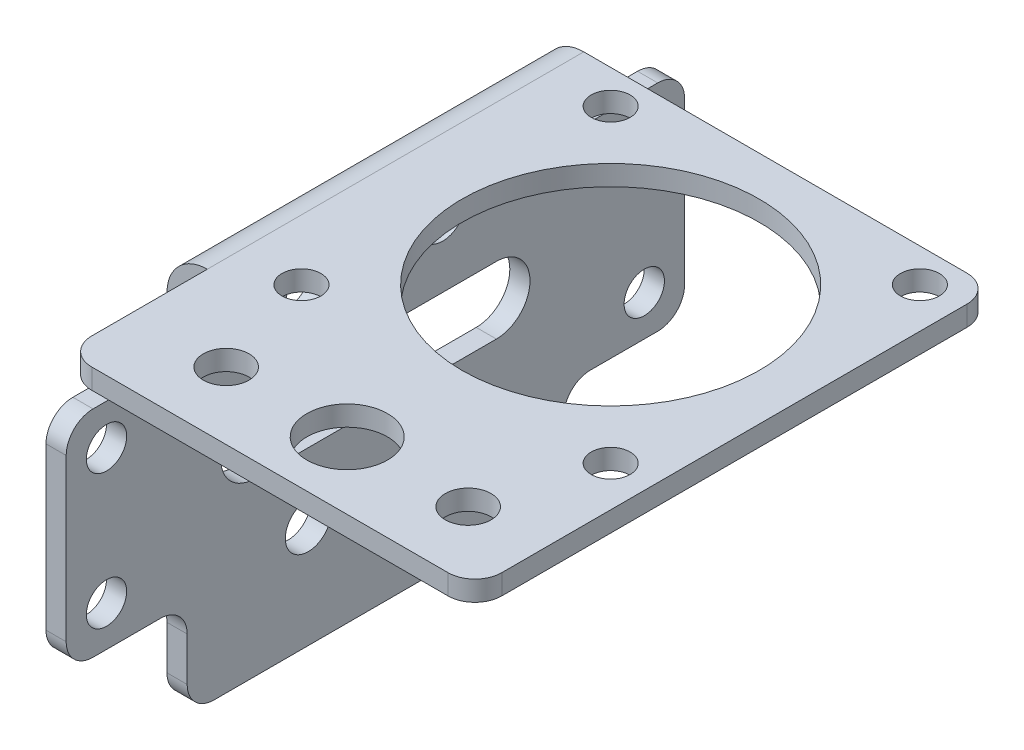
from build123d import *

# Parameters (mm, degrees)
BASE_FLANGE1_DEPTH     = 14
M3_CLEARANCE_HOLE1_D   = 3.4
M2_5_CLEARANCE_HOLE1_D = 2.9
SKETCH10_R             = 11.05
CUT_EXTRUDE1_DEPTH     = 10
SKETCH11_R             = 3
BOSS_EXTRUDE1_DEPTH    = 1.5
M3_CLEARANCE_HOLE2_D   = 3.4
SKETCH14_W             = 9
SKETCH14_H             = 16
SKETCH14_R             = 1.5
BOSS_EXTRUDE2_DEPTH    = 1.5
SKETCH15_W             = 28
SKETCH15_H             = 4
BOSS_EXTRUDE3_DEPTH    = 1.5
FILLET1_R              = 2
CUT_EXTRUDE2_DEPTH     = 10


# Sheet-metal steps are written as plain solids
with BuildPart() as part:
    # Sketch1 → Base-Flange1 (new, symmetric)
    with BuildSketch(Plane.XY):
        with BuildLine():
            Line((0, -24), (0, -1.5))
            ThreePointArc((0, -1.5), (0.439339828, -0.439339828), (1.5, 0))
            Line((1.5, 0), (32, 0))
            Line((32, 0), (32, 1.5))
            Line((32, 1.5), (1.5, 1.5))
            ThreePointArc((1.5, 1.5), (-0.621320344, 0.621320344), (-1.5, -1.5))
            Line((-1.5, -1.5), (-1.5, -24))
            Line((-1.5, -24), (0, -24))
        make_face()
    extrude(amount=BASE_FLANGE1_DEPTH, both=True)

    # M3 Clearance Hole1 (through all)
    with Locations(Plane.ZY.offset(1.5)):
        with Locations((-5, -5.25), (-5, -20.25), (5, -5.25), (5, -20.25)):
            Hole(M3_CLEARANCE_HOLE1_D / 2)

    # M2.5 Clearance Hole1 (through all)
    with Locations(Plane(origin=(0, 1.5, 0), x_dir=(1, 0, 0), z_dir=(0, 1, 0))):
        with Locations((29, 11.5), (29, -11.5), (6, -11.5), (6, 11.5)):
            Hole(M2_5_CLEARANCE_HOLE1_D / 2)

    # Sketch10 → Cut-Extrude1 (cut)
    with BuildSketch(Plane(origin=(0, 1.5, 0), x_dir=(1, 0, 0), z_dir=(0, 1, 0))):
        with Locations(Location((17.5, 0, 0), (0, 0, 270))):
            Circle(SKETCH10_R)
    extrude(amount=-CUT_EXTRUDE1_DEPTH, mode=Mode.SUBTRACT)

    # Sketch11 → Boss-Extrude1 (add)
    with BuildSketch(Plane(origin=(0, 1.5, 0), x_dir=(1, 0, 0), z_dir=(0, 1, 0))):
        Polygon((32, -14), (1.5, -14), (1.5, -24.597), (17.5, -24.597), (32, -24.597), align=None)
        with Locations(Location((17.5, -19.597, 0), (0, 0, 270))):
            Circle(SKETCH11_R, mode=Mode.SUBTRACT)
    extrude(amount=-BOSS_EXTRUDE1_DEPTH)

    # M3 Clearance Hole2 (through all)
    with Locations(Plane(origin=(0, 0, 0), x_dir=(-1, 0, 0), z_dir=(0, -1, 0))):
        with Locations((-26.5, -19.597), (-8.5, -19.597)):
            Hole(M3_CLEARANCE_HOLE2_D / 2)

    # Sketch14 → Boss-Extrude2 (add)
    with BuildSketch(Plane(origin=(0, 0, 0), x_dir=(0, 0, -1), z_dir=(1, 0, 0))):
        with Locations((18.5, -12.75)):
            Rectangle(SKETCH14_W, SKETCH14_H)
        with Locations((20, -7.75)):
            Circle(SKETCH14_R, mode=Mode.SUBTRACT)
        with Locations((20, -17.75)):
            Circle(SKETCH14_R, mode=Mode.SUBTRACT)
    boss_extrude2 = extrude(amount=-BOSS_EXTRUDE2_DEPTH)

    # Mirror1: Boss-Extrude2 across plane
    add(boss_extrude2.mirror(Plane.XY))

    # Sketch15 → Boss-Extrude3 (add)
    with BuildSketch(Plane(origin=(0, 0, 0), x_dir=(0, 0, -1), z_dir=(1, 0, 0))):
        with Locations((0, -26)):
            Rectangle(SKETCH15_W, SKETCH15_H)
    extrude(amount=-BOSS_EXTRUDE3_DEPTH)

    # Fillet1
    fillet1_edges = [part.edges().sort_by_distance(p)[0] for p in [
        (-0.75, -20.75, -14),
        (-0.75, -4.75, -14),
        (-0.75, -4.75, -23),
        (-0.75, -20.75, -23),
        (-0.75, -4.75, 14),
        (-0.75, -20.75, 14),
        (-0.75, -20.75, 23),
        (-0.75, -4.75, 23),
        (-0.75, -28, 14),
        (-0.75, -28, -14),
        (1.5, 0.75, 24.597),
        (32, 0.75, 24.597),
        (32, 0.75, -14),
    ]]
    fillet(fillet1_edges, radius=FILLET1_R)

    # Sketch16 → Cut-Extrude2 (cut)
    with BuildSketch(Plane(origin=(0, 0, 0), x_dir=(0, 0, -1), z_dir=(1, 0, 0))):
        with BuildLine():
            Line((-9, -10.25), (9, -10.25))
            ThreePointArc((9, -10.25), (11.5, -12.75), (9, -15.25))
            Line((9, -15.25), (-9, -15.25))
            ThreePointArc((-9, -15.25), (-11.5, -12.75), (-9, -10.25))
        make_face()
    extrude(amount=-CUT_EXTRUDE2_DEPTH, mode=Mode.SUBTRACT)


solid = part.part
